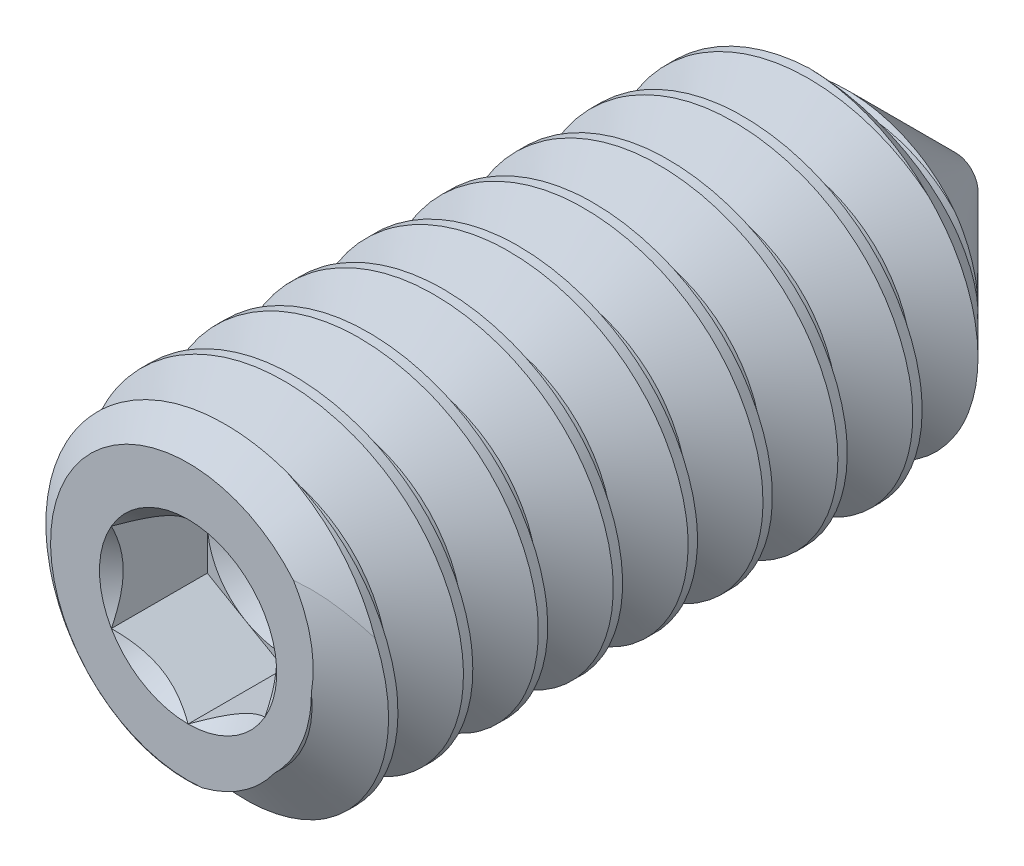
from build123d import *

# Parameters (mm, degrees)
CUT_SWEEP2_PITCH    = 0.619512195
CUT_EXTRUDE10_DEPTH = 0.79375


with BuildPart() as part:
    # Sketch22 → Revolve1 (revolve)
    with BuildSketch(Plane(origin=(0, 0, 0), x_dir=(0, 0, -1), z_dir=(1, 0, 0)), mode=Mode.PRIVATE) as revolve1_sk:
        Polygon((-3.175, 0), (-3.175, 1.13792), (-2.97580496, 1.4224), (1.937512, 1.4224), (3.175, 0.184912), (3.175, 0), align=None)
    revolve(revolve1_sk.sketch.rotate(Axis((0, 0, -3.175), (0, 0, 1)), 90), axis=Axis((0, 0, -3.175), (0, 0, 1)))

    # Cut-Sweep2: the profile of Sketch28 profile screwed along a right-hand helix of 11.25 turns, 6 arcs to a turn; built about Z, then put on its axis
    cut_sweep2_z = Axis((0, 0, 0), (0, 0, 1))
    cut_sweep2_corners = [(1.4227, 0, 0.000173205), (1.4227, 0, -0.542246376), (1.020015026, 0, -0.309756098), (1.020015026, 0, -0.232317073)]
    with BuildLine(mode=Mode.PRIVATE) as cut_sweep2_profile:
        Line(cut_sweep2_corners[0], cut_sweep2_corners[1])
        Line(cut_sweep2_corners[1], cut_sweep2_corners[2])
        Line(cut_sweep2_corners[2], cut_sweep2_corners[3])
        Line(cut_sweep2_corners[3], cut_sweep2_corners[0])
    cut_sweep2_cap = Face(cut_sweep2_profile.wire())
    cut_sweep2_turn_angles = [0, 30, 60, 90, 120, 150, 180, 210, 240, 270, 300, 330, 360]
    cut_sweep2_turn_weights = [1, 0.8660254037844387, 1, 0.8660254037844387, 1, 0.8660254037844387, 1, 0.8660254037844387, 1, 0.8660254037844387, 1, 0.8660254037844387, 1]
    cut_sweep2_turn_rails = [Edge.make_bspline([Vector(p[0], p[1], 0).rotate(cut_sweep2_z, cut_sweep2_turn_angles[k]) / cut_sweep2_turn_weights[k] + Vector(0, 0, p[2] + CUT_SWEEP2_PITCH * cut_sweep2_turn_angles[k] / 360) for k in range(13)], [0, 0, 0, 1, 1, 2, 2, 3, 3, 4, 4, 5, 5, 6, 6, 6], 2, cut_sweep2_turn_weights) for p in cut_sweep2_corners]
    cut_sweep2_turn_sides = [Face.make_surface_from_curves(cut_sweep2_turn_rails[p[0]], cut_sweep2_turn_rails[p[1]]) for p in [(0, 1), (1, 2), (2, 3), (3, 0)]]
    cut_sweep2_last_angles = [3960, 3990, 4020, 4035, 4050]
    cut_sweep2_last_weights = [1, 0.8660254037844387, 1, 0.9659258262890673, 1]
    cut_sweep2_last_rails = [Edge.make_bspline([Vector(p[0], p[1], 0).rotate(cut_sweep2_z, cut_sweep2_last_angles[k]) / cut_sweep2_last_weights[k] + Vector(0, 0, p[2] + CUT_SWEEP2_PITCH * cut_sweep2_last_angles[k] / 360) for k in range(5)], [0, 0, 0, 1, 1, 2, 2, 2], 2, cut_sweep2_last_weights) for p in cut_sweep2_corners]
    cut_sweep2_last_sides = [Face.make_surface_from_curves(cut_sweep2_last_rails[p[0]], cut_sweep2_last_rails[p[1]]) for p in [(0, 1), (1, 2), (2, 3), (3, 0)]]
    cut_sweep2 = Plane(origin=(0, 0, -3.175), x_dir=(0, 1, 0), z_dir=(0, 0, 1)) * Solid(Shell([*[p.moved(Location((0, 0, CUT_SWEEP2_PITCH * i))) for i in range(11) for p in cut_sweep2_turn_sides], *cut_sweep2_last_sides, cut_sweep2_cap, cut_sweep2_cap.rotate(cut_sweep2_z, 4050).moved(Location((0, 0, CUT_SWEEP2_PITCH * 4050 / 360)))]))
    add(cut_sweep2, mode=Mode.SUBTRACT)

    # Sketch23 → Cut-Extrude10 (cut)
    with BuildSketch(Plane.XY.offset(3.175)):
        Polygon((0, 0.733234842), (-0.635, 0.366617421), (-0.635, -0.366617421), (0, -0.733234842), (0.635, -0.366617421), (0.635, 0.366617421), align=None)
    extrude(amount=-CUT_EXTRUDE10_DEPTH, mode=Mode.SUBTRACT)

    # Cut-Extrude11 cone 1 section (through the dimple's axis) → Cut-Extrude11 (revolve, cut)
    with BuildSketch(Plane(origin=(0, 0, 3.175), x_dir=(0, -1, 0), z_dir=(1, 0, 0))):
        Polygon((0, 0), (0.733234842, 0), (0, 0.733234842), align=None)
    revolve(axis=Axis((0, 0, 3.175), (0, 0, -1)), mode=Mode.SUBTRACT)

    # Cut-Extrude12 cone 1 section (through the dimple's axis) → Cut-Extrude12 (revolve, cut)
    with BuildSketch(Plane(origin=(0, 0, 2.38125), x_dir=(0, -1, 0), z_dir=(1, 0, 0))):
        Polygon((0, 0), (0.635, 0), (0, 0.366617421), align=None)
    revolve(axis=Axis((0, 0, 2.38125), (0, 0, -1)), mode=Mode.SUBTRACT)


solid = part.part
